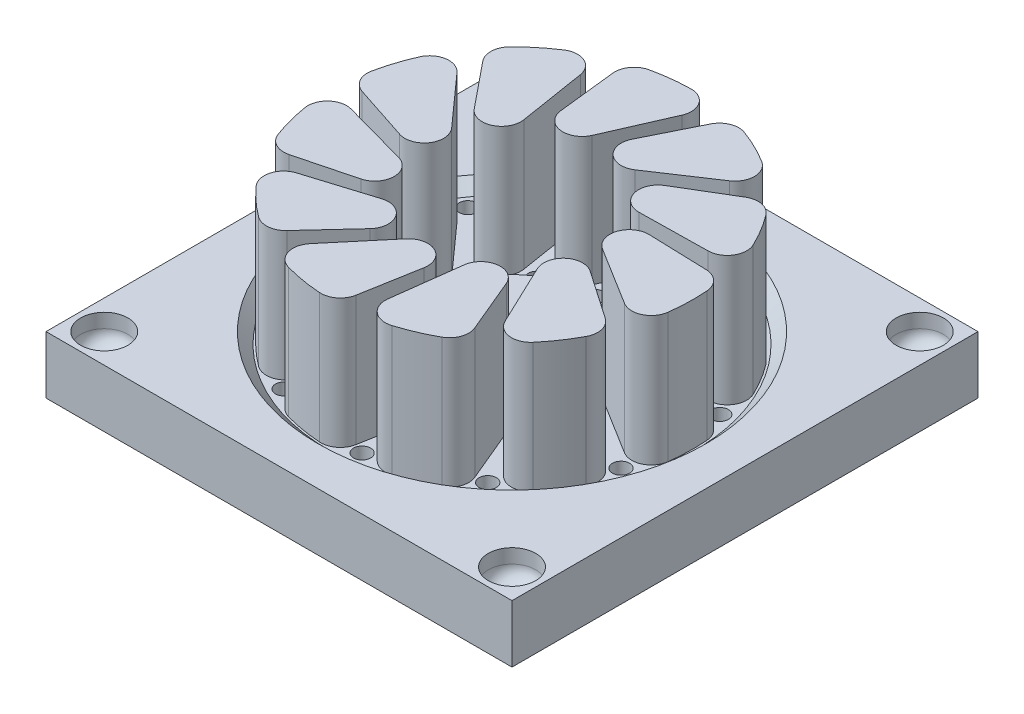
from build123d import *

# Parameters (mm, degrees)
SKETCH1_W               = 36
SKETCH1_H               = 36
BOSS_EXTRUDE1_DEPTH     = 6.5
SKETCH2_R               = 14
SKETCH2_R_2             = 5.9
BOSS_EXTRUDE2_DEPTH     = 9.15
CAVITY1_START           = 5.65
CAVITY1_OUTLINE_R       = 5.4
CAVITY1_DEPTH           = 10
SKETCH5_W               = 36
SKETCH5_H               = 36
CUT_EXTRUDE1_DEPTH      = 8.55
SKETCH6_R               = 1.83
CUT_EXTRUDE2_DEPTH      = 2.1
FILLET1_R               = 1
CUT_EXTRUDE3_DEPTH      = 28.349588662
CUT_EXTRUDE3_DEPTH_BACK = 28.349588662
SKETCH7_R               = 0.665


with BuildPart() as part:
    # Sketch1 → Boss-Extrude1 (new, symmetric)
    with BuildSketch(Plane(origin=(0, 0, 0), x_dir=(1, 0, 0), z_dir=(0, 1, 0))):
        Rectangle(SKETCH1_W, SKETCH1_H)
    extrude(amount=BOSS_EXTRUDE1_DEPTH, both=True)

    # Sketch2 → Boss-Extrude2 (add)
    with BuildSketch(Plane(origin=(0, 6.5, 0), x_dir=(1, 0, 0), z_dir=(0, 1, 0))):
        with Locations(Location((0, 0, 0), (0, 0, 270))):
            Circle(SKETCH2_R)
        with Locations(Location((0, 0, 0), (0, 0, 270))):
            Circle(SKETCH2_R_2, mode=Mode.SUBTRACT)
    extrude(amount=BOSS_EXTRUDE2_DEPTH)

    # Cavity1: read off the stored shape, not the designer's step
    # Cavity1 outline → Cavity1 (cut)
    with BuildSketch(Plane(origin=(0, 0, 0), x_dir=(1, 0, 0), z_dir=(0, 1, 0)).offset(CAVITY1_START)):
        with BuildLine():
            Line((-4.533292403, -11.068981767), (-1.149066665, -7.035818585))
            ThreePointArc((-1.149066665, -7.035818585), (0.633927393, -6.640538319), (1.47721163, -8.260472267))
            Line((1.47721163, -8.260472267), (0.68813613, -12.7355418))
            ThreePointArc((0.68813613, -12.7355418), (0.138338934, -13.654010782), (-0.883764559, -13.972077877))
            ThreePointArc((-0.883764559, -13.972077877), (1.633368507, -13.904391656), (4.097662599, -13.3869026))
            ThreePointArc((4.097662599, -13.3869026), (2.691904846, -13.099521272), (2.170695102, -11.762702927))
            Line((2.170695102, -11.762702927), (2.83719432, -6.540139582))
            ThreePointArc((2.83719432, -6.540139582), (4.123439724, -5.243649297), (5.708657981, -6.150510574))
            Line((5.708657981, -6.150510574), (7.46425068, -10.341785051))
            ThreePointArc((7.46425068, -10.341785051), (7.498293668, -11.411693133), (6.810405547, -12.231859069))
            ThreePointArc((6.810405547, -12.231859069), (8.891358698, -10.814052918), (10.684679103, -9.046415448))
            ThreePointArc((10.684679103, -9.046415448), (9.346710352, -9.564664912), (8.185502249, -8.721849019))
            Line((8.185502249, -8.721849019), (5.922666155, -3.968012472))
            ThreePointArc((5.922666155, -3.968012472), (6.303789078, -2.181938673), (8.127645759, -2.087805232))
            Line((8.127645759, -2.087805232), (11.870518379, -4.664584621))
            ThreePointArc((11.870518379, -4.664584621), (12.477593142, -5.546243546), (12.342320013, -6.608111432))
            ThreePointArc((12.342320013, -6.608111432), (13.326405326, -4.290328786), (13.879385486, -1.833755311))
            ThreePointArc((13.879385486, -1.833755311), (13.03400136, -2.993095023), (11.601470268, -2.911869673))
            Line((11.601470268, -2.911869673), (7.127733334, -0.136069439))
            ThreePointArc((7.127733334, -0.136069439), (6.48272994, 1.572522062), (7.966163435, 2.63776352))
            Line((7.966163435, 2.63776352), (12.507980365, 2.493588468))
            ThreePointArc((12.507980365, 2.493588468), (13.495344957, 2.08009918), (13.955635081, 1.113664893))
            ThreePointArc((13.955635081, 1.113664893), (13.530412422, 3.59554442), (12.667485044, 5.961109181))
            ThreePointArc((12.667485044, 5.961109181), (12.583089031, 4.528761388), (11.334053449, 3.82260772))
            Line((11.334053449, 3.82260772), (6.069795541, 3.73907468))
            ThreePointArc((6.069795541, 3.73907468), (4.603449851, 4.827718154), (5.275480507, 6.525860991))
            Line((5.275480507, 6.525860991), (9.174246963, 8.860064838))
            ThreePointArc((9.174246963, 8.860064838), (10.228420101, 9.046025113), (11.138134616, 8.481860484))
            ThreePointArc((11.138134616, 8.481860484), (9.438609176, 10.339857679), (7.433747604, 11.863363627))
            ThreePointArc((7.433747604, 11.863363627), (8.137134842, 10.612768057), (7.468154743, 9.343434171))
            Line((7.468154743, 9.343434171), (3.084740551, 6.427089007))
            ThreePointArc((3.084740551, 6.427089007), (1.262606961, 6.550147844), (0.909869793, 8.342043708))
            Line((0.909869793, 8.342043708), (2.927754972, 12.413533223))
            ThreePointArc((2.927754972, 12.413533223), (3.714044133, 13.139901989), (4.78435511, 13.157125301))
            ThreePointArc((4.78435511, 13.157125301), (2.350114207, 13.801339182), (-0.160152175, 13.999083944))
            ThreePointArc((-0.160152175, 13.999083944), (1.107697836, 13.327295854), (1.231169673, 11.89778629))
            Line((1.231169673, 11.89778629), (-0.879697769, 7.074547986))
            ThreePointArc((-0.879697769, 7.074547986), (-2.479104719, 6.192951873), (-3.744618151, 7.509686489))
            Line((-3.744618151, 7.509686489), (-4.248278536, 12.02579252))
            ThreePointArc((-4.248278536, 12.02579252), (-3.979514604, 13.061952825), (-3.08842334, 13.655095799))
            ThreePointArc((-3.08842334, 13.655095799), (-5.484525418, 12.88099301), (-7.70320477, 11.690194022))
            ThreePointArc((-7.70320477, 11.690194022), (-6.273425408, 11.810501383), (-5.396703069, 10.674675328))
            Line((-5.396703069, 10.674675328), (-4.564838262, 5.475887966))
            ThreePointArc((-4.564838262, 5.475887966), (-5.433718166, 3.869537441), (-7.210216291, 4.293056871))
            Line((-7.210216291, 4.293056871), (-10.075513626, 7.819947663))
            ThreePointArc((-10.075513626, 7.819947663), (-10.409605573, 8.836925932), (-9.980649201, 9.817669863))
            ThreePointArc((-9.980649201, 9.817669863), (-11.577866975, 7.871022571), (-12.800544279, 5.669750096))
            ThreePointArc((-12.800544279, 5.669750096), (-11.66278041, 6.543956173), (-10.311160718, 6.062430373))
            Line((-10.311160718, 6.062430373), (-6.800674861, 2.138672207))
            ThreePointArc((-6.800674861, 2.138672207), (-6.663164489, 0.317572211), (-8.386621704, -0.28658797))
            Line((-8.386621704, -0.28658797), (-12.703844329, 1.131324675))
            ThreePointArc((-12.703844329, 1.131324675), (-13.534720323, 1.806237493), (-13.70408946, 2.863203114))
            ThreePointArc((-13.70408946, 2.863203114), (-13.995317572, 0.362058079), (-13.833801424, -2.150799424))
            ThreePointArc((-13.833801424, -2.150799424), (-13.349285037, -0.800248885), (-11.951897694, -0.474593391))
            Line((-11.951897694, -0.474593391), (-6.877345242, -1.877556866))
            ThreePointArc((-6.877345242, -1.877556866), (-5.777103166, -3.335219951), (-6.900333982, -4.775243156))
            Line((-6.900333982, -4.775243156), (-11.29879422, -5.916485904))
            ThreePointArc((-11.29879422, -5.916485904), (-12.362657002, -5.797918587), (-13.076578144, -5.000310394))
            ThreePointArc((-13.076578144, -5.000310394), (-11.969353727, -7.261857295), (-10.474924362, -9.288485324))
            ThreePointArc((-10.474924362, -9.288485324), (-10.797485986, -7.890380576), (-9.7979916, -6.860937106))
            Line((-9.7979916, -6.860937106), (-4.770507103, -5.2976749))
            ThreePointArc((-4.770507103, -5.2976749), (-3.056852407, -5.929103345), (-3.223238977, -7.74779238))
            Line((-3.223238977, -7.74779238), (-6.306456779, -11.085854011))
            ThreePointArc((-6.306456779, -11.085854011), (-7.265537434, -11.561276482), (-8.297345663, -11.276260681))
            ThreePointArc((-8.297345663, -11.276260681), (-6.143204645, -12.580184287), (-3.790332827, -13.477142763))
            ThreePointArc((-3.790332827, -13.477142763), (-4.817561427, -12.475372185), (-4.533292403, -11.068981767))
        make_face()
        Circle(CAVITY1_OUTLINE_R, mode=Mode.SUBTRACT)
    extrude(amount=CAVITY1_DEPTH, mode=Mode.SUBTRACT)

    # Cavity1 2 outline → Cavity1 2 (revolve, cut)
    with BuildSketch(Plane.XY):
        Polygon((14, 6.5), (14, 5.65), (14.15, 5.65), (15, 6.5), align=None)
    revolve(axis=Axis((0, 0, 0), (0, 1, 0)), mode=Mode.SUBTRACT)

    # Sketch5 → Cut-Extrude1 (cut)
    with BuildSketch(Plane.XZ.offset(6.5)):
        Rectangle(SKETCH5_W, SKETCH5_H)
    extrude(amount=-CUT_EXTRUDE1_DEPTH, mode=Mode.SUBTRACT)

    # Sketch6 → Cut-Extrude2 (cut)
    with BuildSketch(Plane(origin=(0, 6.5, 0), x_dir=(1, 0, 0), z_dir=(0, 1, 0))):
        with Locations(Location((-15.75, -15.75, 0), (0, 0, 270))):
            Circle(SKETCH6_R)
        with Locations(Location((15.75, -15.75, 0), (0, 0, 270))):
            Circle(SKETCH6_R)
        with Locations(Location((15.75, 15.75, 0), (0, 0, 270))):
            Circle(SKETCH6_R)
        with Locations(Location((-15.75, 15.75, 0), (0, 0, 270))):
            Circle(SKETCH6_R)
    extrude(amount=-CUT_EXTRUDE2_DEPTH, mode=Mode.SUBTRACT)

    # Fillet1
    fillet1_edges = [part.edges().sort_by_distance(p)[0] for p in [
        (15.75, 4.4, -17.58),
        (-15.75, 4.4, 13.92),
        (-15.75, 4.4, -17.58),
        (15.75, 4.4, 13.92),
    ]]
    fillet(fillet1_edges, radius=FILLET1_R)

    # Sketch7 → Cut-Extrude3 (cut, two sides: drawn at the far end of the back side and taken through both)
    with BuildSketch(Plane(origin=(0, 5.65, 0), x_dir=(1, 0, 0), z_dir=(0, 1, 0)).offset(-CUT_EXTRUDE3_DEPTH_BACK)):
        with Locations(Location((0, 6.4, 0), (0, 0, 270))):
            Circle(SKETCH7_R)
        with Locations(Location((2.257018876, 12.954858772, 0), (0, 0, 270))):
            Circle(SKETCH7_R)
        with Locations(Location((3.460101232, 5.38402261, 0), (0, 0, 270))):
            Circle(SKETCH7_R)
        with Locations(Location((8.90265054, 9.678084179, 0), (0, 0, 270))):
            Circle(SKETCH7_R)
        with Locations(Location((5.82164477, 2.658656083, 0), (0, 0, 270))):
            Circle(SKETCH7_R)
        with Locations(Location((12.72175356, 3.328586241, 0), (0, 0, 270))):
            Circle(SKETCH7_R)
        with Locations(Location((6.334857228, -0.910814965, 0), (0, 0, 270))):
            Circle(SKETCH7_R)
        with Locations(Location((12.501789712, -4.077714309, 0), (0, 0, 270))):
            Circle(SKETCH7_R)
        with Locations(Location((4.836797276, -4.191108697, 0), (0, 0, 270))):
            Circle(SKETCH7_R)
        with Locations(Location((8.312595965, -10.189369378, 0), (0, 0, 270))):
            Circle(SKETCH7_R)
        with Locations(Location((1.803088364, -6.140755031, 0), (0, 0, 270))):
            Circle(SKETCH7_R)
        with Locations(Location((1.484211732, -13.065971664, 0), (0, 0, 270))):
            Circle(SKETCH7_R)
        with Locations(Location((-1.803088364, -6.140755031, 0), (0, 0, 270))):
            Circle(SKETCH7_R)
        with Locations(Location((-5.815399238, -11.794220267, 0), (0, 0, 270))):
            Circle(SKETCH7_R)
        with Locations(Location((-4.836797276, -4.191108697, 0), (0, 0, 270))):
            Circle(SKETCH7_R)
        with Locations(Location((-11.26866204, -6.777887268, 0), (0, 0, 270))):
            Circle(SKETCH7_R)
        with Locations(Location((-6.334857228, -0.910814965, 0), (0, 0, 270))):
            Circle(SKETCH7_R)
        with Locations(Location((-13.144204265, 0.390377048, 0), (0, 0, 270))):
            Circle(SKETCH7_R)
        with Locations(Location((-5.82164477, 2.658656083, 0), (0, 0, 270))):
            Circle(SKETCH7_R)
        with Locations(Location((-10.846554508, 7.434699409, 0), (0, 0, 270))):
            Circle(SKETCH7_R)
        with Locations(Location((-3.460101232, 5.38402261, 0), (0, 0, 270))):
            Circle(SKETCH7_R)
        with Locations(Location((-5.105200333, 12.118557239, 0), (0, 0, 270))):
            Circle(SKETCH7_R)
    extrude(amount=CUT_EXTRUDE3_DEPTH + CUT_EXTRUDE3_DEPTH_BACK, mode=Mode.SUBTRACT)


solid = part.part
